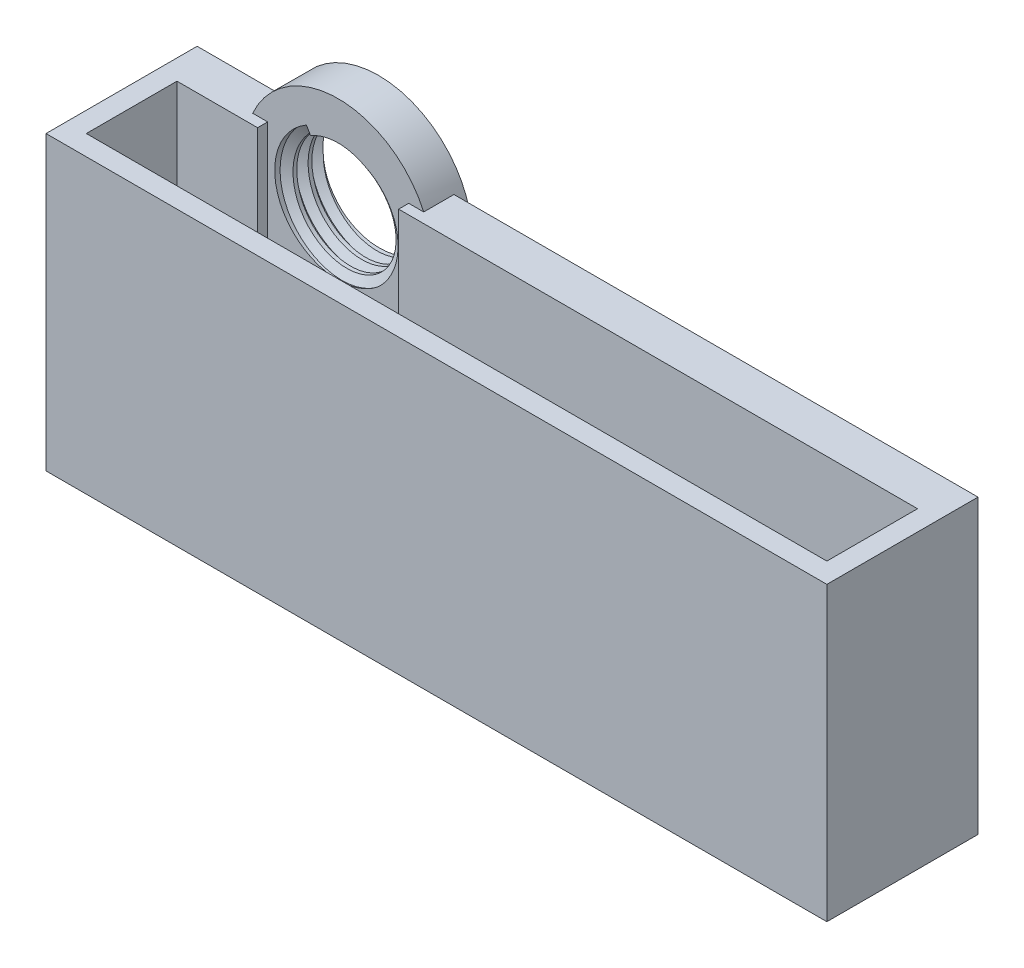
from build123d import *

# Parameters (mm, degrees)
SKIZZE1_W                            = 77.5
SKIZZE1_H                            = 29
AUFSATZ_LINEAR_AUSTRAGEN1_DEPTH      = 15
SKIZZE2_W                            = 73.5
SKIZZE2_H                            = 9
SCHNITT_LINEAR_AUSTRAGEN2_DEPTH      = 27
SKIZZE3_W                            = 14
SKIZZE3_H                            = 3.775324495
SCHNITT_LINEAR_AUSTRAGEN3_DEPTH      = 27
SKIZZE4_R                            = 9.3
AUFSATZ_LINEAR_AUSTRAGEN2_DEPTH      = 4
SCHNITT_LINEAR_AUSTRAGEN4_DEPTH      = 4
SCHNITT_LINEAR_AUSTRAGEN4_DEPTH_BACK = 4
SKIZZE5_R                            = 6.3
GEWINDE1_PITCH                       = 1.5
SKIZZE8_R                            = 6.762792794
SCHNITT_LINEAR_AUSTRAGEN5_DEPTH      = 3
SKIZZE9_R                            = 8.045184368
SCHNITT_LINEAR_AUSTRAGEN6_DEPTH      = 3


with BuildPart() as part:
    # Skizze1 → Aufsatz-Linear austragen1 (new body)
    with BuildSketch(Plane.XY):
        Rectangle(SKIZZE1_W, SKIZZE1_H)
    extrude(amount=AUFSATZ_LINEAR_AUSTRAGEN1_DEPTH)

    # Skizze2 → Schnitt-Linear austragen2 (cut)
    with BuildSketch(Plane(origin=(0, 14.5, 0), x_dir=(1, 0, 0), z_dir=(0, 1, 0))):
        with Locations((0, -8.5)):
            Rectangle(SKIZZE2_W, SKIZZE2_H)
    extrude(amount=-SCHNITT_LINEAR_AUSTRAGEN2_DEPTH, mode=Mode.SUBTRACT)

    # Skizze3 → Schnitt-Linear austragen3 (cut)
    with BuildSketch(Plane(origin=(0, 14.5, 0), x_dir=(1, 0, 0), z_dir=(0, 1, 0))):
        with Locations((-21.75, -4.887662247)):
            Rectangle(SKIZZE3_W, SKIZZE3_H)
    extrude(amount=-SCHNITT_LINEAR_AUSTRAGEN3_DEPTH, mode=Mode.SUBTRACT)

    # Skizze4 → Aufsatz-Linear austragen2 (add)
    with BuildSketch(Plane.XY.offset(3)):
        with Locations((-21.75, 10.7)):
            Circle(SKIZZE4_R)
    extrude(amount=-AUFSATZ_LINEAR_AUSTRAGEN2_DEPTH)

    # Skizze5 → Schnitt-Linear austragen4 (cut, two sides: drawn at the far end of the back side and taken through both)
    with BuildSketch(Plane(origin=(0, 0, 0), x_dir=(-1, 0, 0), z_dir=(0, 0, -1)).offset(-SCHNITT_LINEAR_AUSTRAGEN4_DEPTH_BACK)):
        with Locations((21.75, 10.7)):
            Circle(SKIZZE5_R)
    extrude(amount=SCHNITT_LINEAR_AUSTRAGEN4_DEPTH + SCHNITT_LINEAR_AUSTRAGEN4_DEPTH_BACK, mode=Mode.SUBTRACT)

    # Gewinde1: the profile of Gewindeprofil1 profile screwed along a right-hand helix of 3.333333 turns, 8 arcs to a turn; built about Z, then put on its axis
    gewinde1_z = Axis((0, 0, 0), (0, 0, 1))
    gewinde1_corners = [(6.3003, 0, -0.000173205), (6.3003, 0, 1.312673201), (5.488101188, 0, 0.843749998), (5.488101188, 0, 0.468749998)]
    with BuildLine(mode=Mode.PRIVATE) as gewinde1_profile:
        Line(gewinde1_corners[0], gewinde1_corners[1])
        Line(gewinde1_corners[1], gewinde1_corners[2])
        Line(gewinde1_corners[2], gewinde1_corners[3])
        Line(gewinde1_corners[3], gewinde1_corners[0])
    gewinde1_cap = Face(gewinde1_profile.wire())
    gewinde1_turn_angles = [0, 22.5, 45, 67.5, 90, 112.5, 135, 157.5, 180, 202.5, 225, 247.5, 270, 292.5, 315, 337.5, 360]
    gewinde1_turn_weights = [1, 0.9238795325112867, 1, 0.9238795325112867, 1, 0.9238795325112867, 1, 0.9238795325112867, 1, 0.9238795325112867, 1, 0.9238795325112867, 1, 0.9238795325112867, 1, 0.9238795325112867, 1]
    gewinde1_turn_rails = [Edge.make_bspline([Vector(p[0], p[1], 0).rotate(gewinde1_z, gewinde1_turn_angles[k]) / gewinde1_turn_weights[k] + Vector(0, 0, p[2] + GEWINDE1_PITCH * gewinde1_turn_angles[k] / 360) for k in range(17)], [0, 0, 0, 1, 1, 2, 2, 3, 3, 4, 4, 5, 5, 6, 6, 7, 7, 8, 8, 8], 2, gewinde1_turn_weights) for p in gewinde1_corners]
    gewinde1_turn_sides = [Face.make_surface_from_curves(gewinde1_turn_rails[p[0]], gewinde1_turn_rails[p[1]]) for p in [(0, 1), (1, 2), (2, 3), (3, 0)]]
    gewinde1_last_angles = [1080, 1102.5, 1125, 1147.5, 1170, 1185, 1200]
    gewinde1_last_weights = [1, 0.9238795325112867, 1, 0.9238795325112867, 1, 0.9659258262890688, 1]
    gewinde1_last_rails = [Edge.make_bspline([Vector(p[0], p[1], 0).rotate(gewinde1_z, gewinde1_last_angles[k]) / gewinde1_last_weights[k] + Vector(0, 0, p[2] + GEWINDE1_PITCH * gewinde1_last_angles[k] / 360) for k in range(7)], [0, 0, 0, 1, 1, 2, 2, 3, 3, 3], 2, gewinde1_last_weights) for p in gewinde1_corners]
    gewinde1_last_sides = [Face.make_surface_from_curves(gewinde1_last_rails[p[0]], gewinde1_last_rails[p[1]]) for p in [(0, 1), (1, 2), (2, 3), (3, 0)]]
    gewinde1 = Plane(origin=(-21.75, 10.7, -2.6), x_dir=(1, 0, 0), z_dir=(0, 0, 1)) * Solid(Shell([*[p.moved(Location((0, 0, GEWINDE1_PITCH * i))) for i in range(3) for p in gewinde1_turn_sides], *gewinde1_last_sides, gewinde1_cap, gewinde1_cap.rotate(gewinde1_z, 1200).moved(Location((0, 0, GEWINDE1_PITCH * 1200 / 360)))]))
    add(gewinde1)

    # Skizze8 → Schnitt-Linear austragen5 (cut)
    with BuildSketch(Plane.XY.offset(3)):
        with Locations((-21.75, 10.7)):
            Circle(SKIZZE8_R)
    extrude(amount=SCHNITT_LINEAR_AUSTRAGEN5_DEPTH, mode=Mode.SUBTRACT)

    # Skizze9 → Schnitt-Linear austragen6 (cut)
    with BuildSketch(Plane(origin=(0, 0, -1), x_dir=(-1, 0, 0), z_dir=(0, 0, -1))):
        with Locations((21.75, 10.7)):
            Circle(SKIZZE9_R)
    extrude(amount=SCHNITT_LINEAR_AUSTRAGEN6_DEPTH, mode=Mode.SUBTRACT)


solid = part.part
